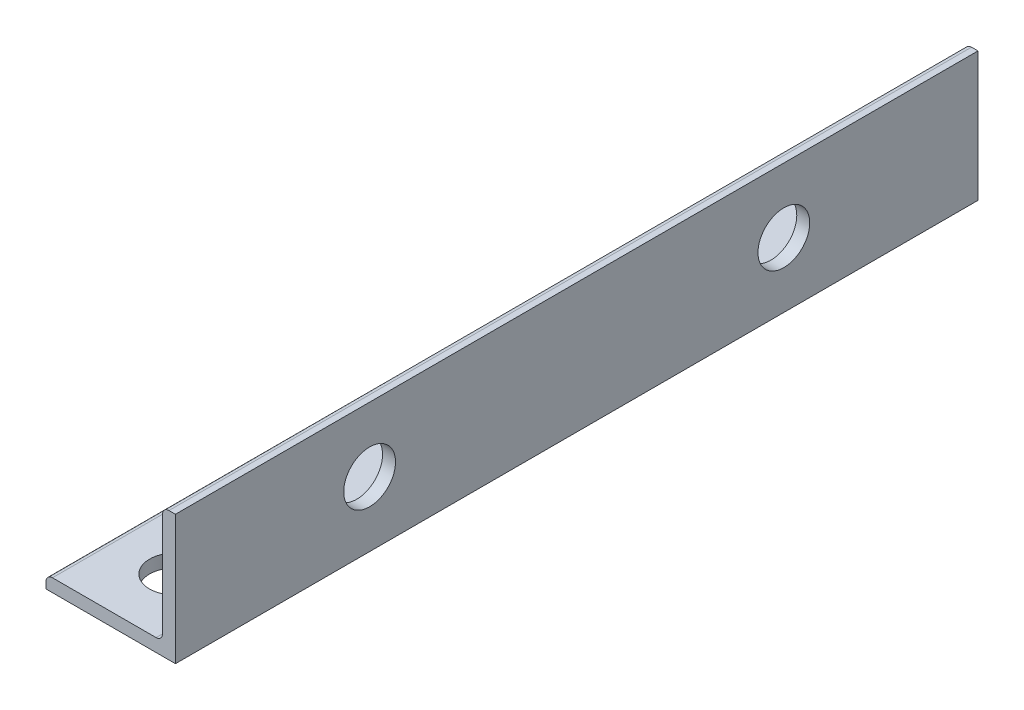
from build123d import *

# Parameters (mm, degrees)
BOSS_EXTRUDE1_DEPTH = 49.2125
SKETCH3_R           = 3.175
CUT_EXTRUDE1_DEPTH  = 55.091601994
CUT_EXTRUDE2_REACH  = 54.315
SKETCH4_R           = 3.175


with BuildPart() as part:
    # Sketch2 → Boss-Extrude1 (new, symmetric)
    with BuildSketch(Plane.XY):
        with BuildLine():
            Line((-7.9375, 0), (7.9375, 0))
            Line((7.9375, 0), (7.9375, 15.875))
            Line((7.9375, 15.875), (7.14375, 15.875))
            ThreePointArc((7.14375, 15.875), (6.582483992, 15.642516008), (6.35, 15.08125))
            Line((6.35, 15.08125), (6.35, 2.38125))
            ThreePointArc((6.35, 2.38125), (6.117516008, 1.819983992), (5.55625, 1.5875))
            Line((5.55625, 1.5875), (-7.14375, 1.5875))
            ThreePointArc((-7.14375, 1.5875), (-7.705016008, 1.355016008), (-7.9375, 0.79375))
            Line((-7.9375, 0.79375), (-7.9375, 0))
        make_face()
    extrude(amount=BOSS_EXTRUDE1_DEPTH, both=True)

    # Sketch3 → Cut-Extrude1 (cut, through all)
    with BuildSketch(Plane(origin=(7.9375, 0, 0), x_dir=(0, 0, -1), z_dir=(1, 0, 0))):
        with Locations((-25.4, 7.9375)):
            Circle(SKETCH3_R)
        with Locations((25.4, 7.9375)):
            Circle(SKETCH3_R)
    extrude(amount=-CUT_EXTRUDE1_DEPTH, mode=Mode.SUBTRACT)

    # Sketch4 → Cut-Extrude2 (cut, up to next)
    with BuildSketch(Plane.XZ, mode=Mode.PRIVATE) as cut_extrude2_sk1:
        with Locations((0, -41.275)):
            Circle(SKETCH4_R)
    cut_extrude2_tool1 = extrude(cut_extrude2_sk1.sketch, amount=-CUT_EXTRUDE2_REACH, mode=Mode.PRIVATE) & part.part
    # Sketch4 → Cut-Extrude2 (cut, up to next)
    with BuildSketch(Plane.XZ, mode=Mode.PRIVATE) as cut_extrude2_sk2:
        with Locations((0, 41.275)):
            Circle(SKETCH4_R)
    cut_extrude2_tool2 = extrude(cut_extrude2_sk2.sketch, amount=-CUT_EXTRUDE2_REACH, mode=Mode.PRIVATE) & part.part
    add(cut_extrude2_tool1.solids().sort_by_distance((0, 0, -41.275))[0], mode=Mode.SUBTRACT)
    add(cut_extrude2_tool2.solids().sort_by_distance((0, 0, 41.275))[0], mode=Mode.SUBTRACT)


solid = part.part
